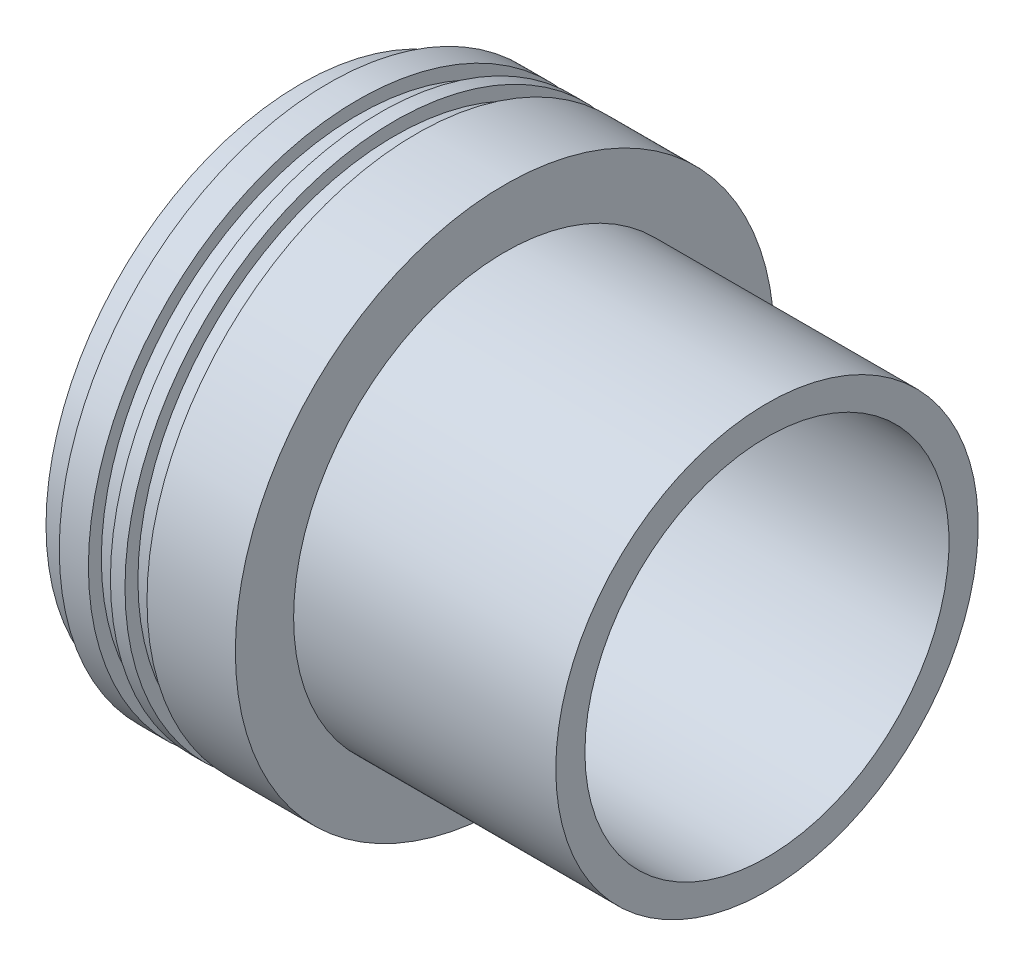
from build123d import *


with BuildPart() as part:
    # Sketch1 → Revolve1 (revolve)
    with BuildSketch(Plane.XY):
        Polygon((0, 9.525), (0, 3.175), (6.06588874, 3.175), (6.06588874, 0), (12.41588874, 0), (12.41588874, 2.8194), (17.21648874, 2.8194), (17.21648874, 0), (20.39148874, 0), (20.39148874, 2.8194), (25.19208874, 2.8194), (25.19208874, 0), (44.45, 0), (44.45, 12.7), (101.6, 12.7), (101.6, 19.05), (34.925, 19.05), (25.4, 9.525), align=None)
    revolve(axis=Axis((0, 58.7375, 0), (1, 0, 0)))


solid = part.part
